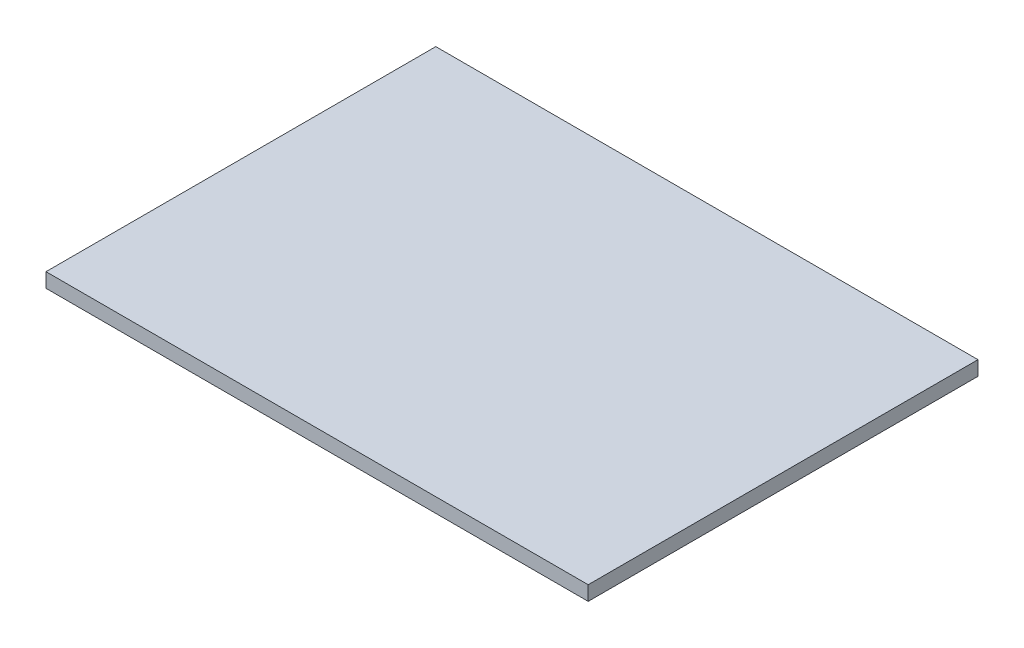
from build123d import *

# Parameters (mm, degrees)
SKETCH1_W           = 338
SKETCH1_H           = 243
BOSS_EXTRUDE1_DEPTH = 9


with BuildPart() as part:
    # Sketch1 → Boss-Extrude1 (new body)
    with BuildSketch(Plane(origin=(0, 0, 0), x_dir=(1, 0, 0), z_dir=(0, 1, 0))):
        Rectangle(SKETCH1_W, SKETCH1_H)
    extrude(amount=BOSS_EXTRUDE1_DEPTH)


solid = part.part
